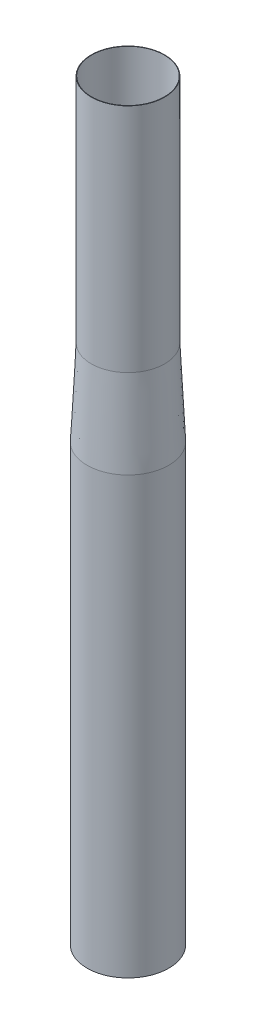
from build123d import *

# Parameters (mm, degrees)
SKETCH1_R           = 314.325
SKETCH1_R_2         = 311.15
BOSS_EXTRUDE1_DEPTH = 3352.8


with BuildPart() as part:
    # Sketch1 → Boss-Extrude1 (new body)
    with BuildSketch(Plane(origin=(0, 0, 0), x_dir=(1, 0, 0), z_dir=(0, 1, 0))):
        Circle(SKETCH1_R)
        Circle(SKETCH1_R_2, mode=Mode.SUBTRACT)
    extrude(amount=BOSS_EXTRUDE1_DEPTH)

    # Sketch2 → Revolve1 (revolve)
    with BuildSketch(Plane.XY):
        Polygon((-314.325, 3352.8), (-282.571336172, 4013.2), (-282.571336172, 5791.2), (-279.4, 5791.2), (-279.4, 4013.123801176), (-311.15, 3352.8), align=None)
    revolve(axis=Axis((0, 3352.8, 0), (0, 1, 0)))


solid = part.part
